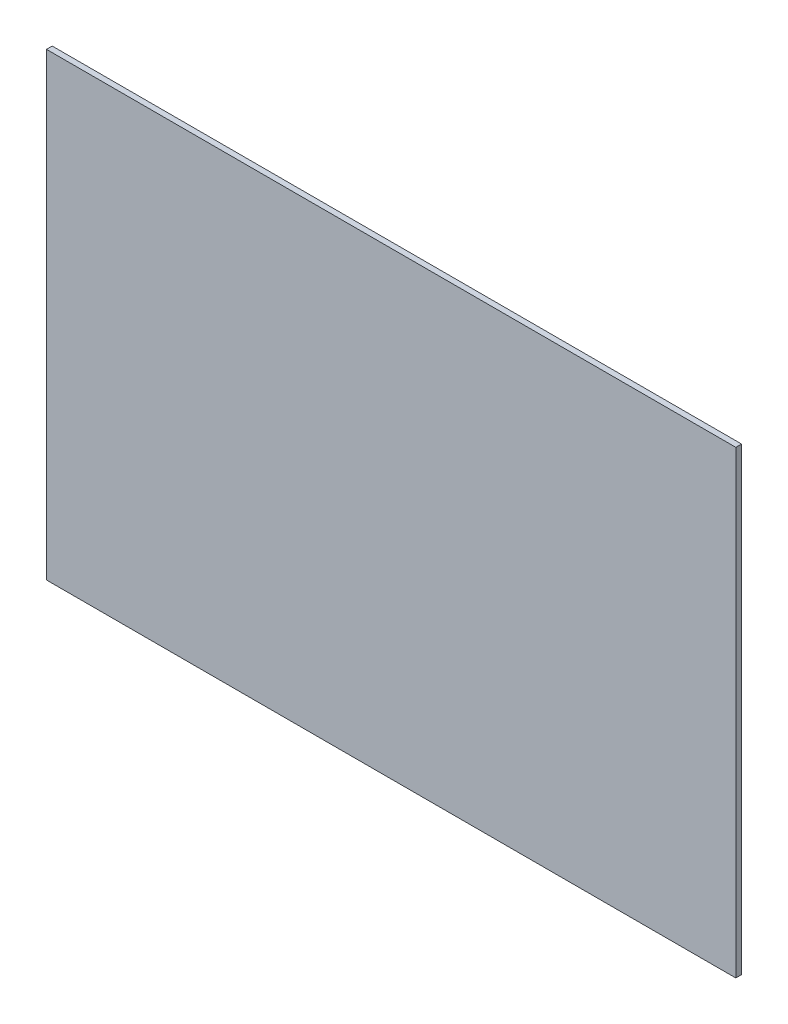
from build123d import *

# Parameters (mm, degrees)
SKETCH1_W           = 304.8
SKETCH1_H           = 203.2
BOSS_EXTRUDE1_DEPTH = 2.54


with BuildPart() as part:
    # Sketch1 → Boss-Extrude1 (new body)
    with BuildSketch(Plane.XY):
        with Locations((152.4, 101.6)):
            Rectangle(SKETCH1_W, SKETCH1_H)
    extrude(amount=BOSS_EXTRUDE1_DEPTH)


solid = part.part
